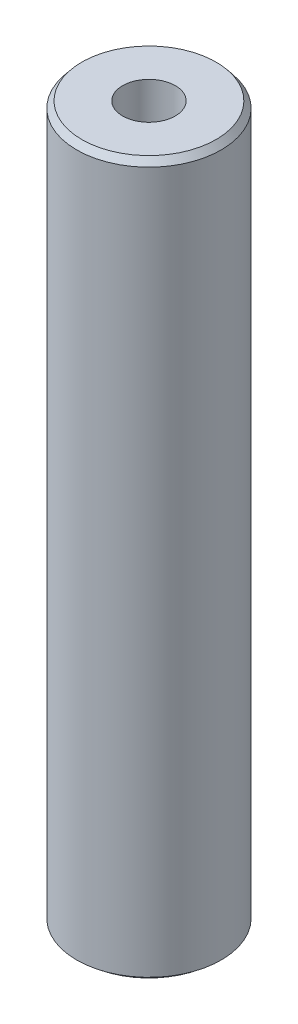
from build123d import *
from OCP.BRepFilletAPI import BRepFilletAPI_MakeChamfer

# Parameters (mm, degrees)
SKETCH1_R           = 57.5
BOSS_EXTRUDE1_DEPTH = 567.393684622
SKETCH2_R           = 20.945175142
CUT_EXTRUDE1_DEPTH  = 574.191149049
CHAMFER1_SIZE       = 5.100046733
CHAMFER1_SIZE2      = 4.083592718


with BuildPart() as part:
    # Sketch1 → Boss-Extrude1 (new body)
    with BuildSketch(Plane(origin=(0, 0, 0), x_dir=(1, 0, 0), z_dir=(0, 1, 0))):
        Circle(SKETCH1_R)
    extrude(amount=BOSS_EXTRUDE1_DEPTH)

    # Sketch2 → Cut-Extrude1 (cut, through all)
    with BuildSketch(Plane(origin=(0, 0, 0), x_dir=(1, 0, 0), z_dir=(0, 1, 0))):
        Circle(SKETCH2_R)
    extrude(amount=CUT_EXTRUDE1_DEPTH, mode=Mode.SUBTRACT)

    # Chamfer1: one chamfer whose edges measure the first distance from different faces: ONE call of the kernel's chamfer builder (chamfer() names one face for all edges)
    chamfer1_edges_1 = [part.edges().sort_by_distance(p)[0] for p in [
        (-57.5, 567.393684622, 0),
    ]]
    chamfer1_side_1 = [part.faces().sort_by_distance(p)[0] for p in [
        (-57.5, 283.696842311, 0),
    ]]
    chamfer1_edges_2 = [part.edges().sort_by_distance(p)[0] for p in [
        (-57.5, 0, 0),
    ]]
    chamfer1_side_2 = [part.faces().sort_by_distance(p)[0] for p in [
        (-55.873654403, 0, 0),
    ]]
    chamfer1 = BRepFilletAPI_MakeChamfer(part.part.solid().wrapped)
    for e in chamfer1_edges_1:
        chamfer1.Add(CHAMFER1_SIZE, CHAMFER1_SIZE2, e.wrapped, chamfer1_side_1[0].wrapped)  # the first distance lies on this face
    for e in chamfer1_edges_2:
        chamfer1.Add(CHAMFER1_SIZE, CHAMFER1_SIZE2, e.wrapped, chamfer1_side_2[0].wrapped)  # the first distance lies on this face
    add(Compound.cast(chamfer1.Shape()), mode=Mode.REPLACE)


solid = part.part
